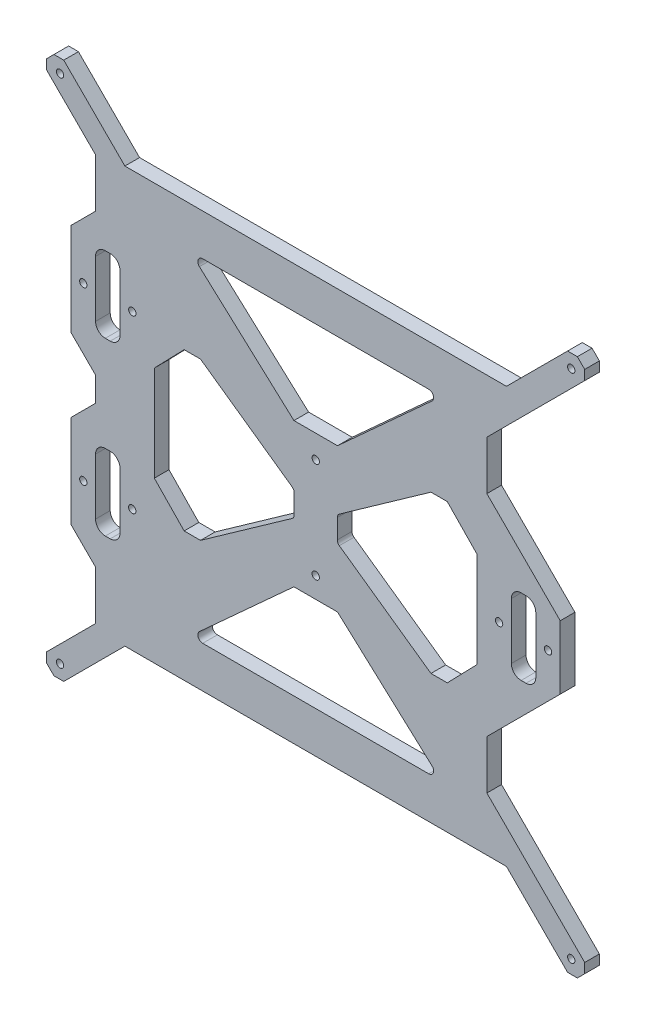
from build123d import *

# Parameters (mm, degrees)
FRAME_R             = 1.5
BOSS_EXTRUDE1_DEPTH = 6


with BuildPart() as part:
    # FRAME → Boss-Extrude1 (new body)
    with BuildSketch(Plane.XY):
        Polygon((65, 325), (63, 325), (60, 322), (60, 320), (60, 318), (80, 298), (80, 278), (70, 268), (70, 230), (80, 220), (80, 210), (70, 200), (70, 162), (80, 152), (80, 132), (60, 112), (60, 108), (63, 105), (65, 105), (67, 105), (92, 130), (248, 130), (273, 105), (275, 105), (277, 105), (280, 108), (280, 112), (260, 132), (240, 152), (240, 172), (260, 192), (270, 202), (270, 228), (260, 238), (240, 258), (240, 278), (280, 318), (280, 321), (280, 322), (277, 325), (273, 325), (250, 302), (248, 300), (92, 300), (67, 325), align=None)
        with Locations((75, 250)):
            Circle(FRAME_R, mode=Mode.SUBTRACT)
        with Locations((95.037619408, 250)):
            Circle(FRAME_R, mode=Mode.SUBTRACT)
        with Locations((75, 180)):
            Circle(FRAME_R, mode=Mode.SUBTRACT)
        with Locations((95, 180)):
            Circle(FRAME_R, mode=Mode.SUBTRACT)
        with Locations((265, 215)):
            Circle(FRAME_R, mode=Mode.SUBTRACT)
        with Locations((245, 215)):
            Circle(FRAME_R, mode=Mode.SUBTRACT)
        with Locations((65.5, 319.5)):
            Circle(FRAME_R, mode=Mode.SUBTRACT)
        with Locations((274.5, 110.5)):
            Circle(FRAME_R, mode=Mode.SUBTRACT)
        with Locations((274.5, 319.5)):
            Circle(FRAME_R, mode=Mode.SUBTRACT)
        with Locations((65.5, 110.5)):
            Circle(FRAME_R, mode=Mode.SUBTRACT)
        with Locations((170.024675872, 194)):
            Circle(FRAME_R, mode=Mode.SUBTRACT)
        with Locations((170.024675872, 235)):
            Circle(FRAME_R, mode=Mode.SUBTRACT)
        with BuildLine():
            Line((161.216590497, 218.964796722), (161.216590497, 211.035203278))
            ThreePointArc((161.216590497, 211.035203278), (160.992764596, 210.115852653), (160.371384926, 209.402276511))
            Line((160.371384926, 209.402276511), (122.909474642, 182.909474642))
            Line((122.909474642, 182.909474642), (116.23015359, 182.909474642))
            Line((116.23015359, 182.909474642), (104.037619408, 195.501934511))
            Line((104.037619408, 195.501934511), (104.037619408, 234.498065489))
            Line((104.037619408, 234.498065489), (116.23015359, 247.090525358))
            Line((116.23015359, 247.090525358), (122.909474642, 247.090525358))
            Line((122.909474642, 247.090525358), (160.371384926, 220.597723489))
            ThreePointArc((160.371384926, 220.597723489), (160.992764596, 219.884147347), (161.216590497, 218.964796722))
        make_face(mode=Mode.SUBTRACT)
        with BuildLine():
            Line((122.471056888, 279.600410825), (161.114699893, 244.435797428))
            Line((161.114699893, 244.435797428), (178.934651851, 244.435797428))
            Line((178.934651851, 244.435797428), (217.578294856, 279.600410825))
            ThreePointArc((217.578294856, 279.600410825), (218.0975061, 281.801285282), (216.232236245, 283.079642455))
            Line((216.232236245, 283.079642455), (123.817115499, 283.079642455))
            ThreePointArc((123.817115499, 283.079642455), (121.951845644, 281.801285282), (122.471056888, 279.600410825))
        make_face(mode=Mode.SUBTRACT)
        with BuildLine():
            Line((217.139877102, 247.090525358), (179.677966818, 220.597723489))
            ThreePointArc((179.677966818, 220.597723489), (179.056587148, 219.884147347), (178.832761247, 218.964796722))
            Line((178.832761247, 218.964796722), (178.832761247, 211.035203278))
            ThreePointArc((178.832761247, 211.035203278), (179.056587148, 210.115852653), (179.677966818, 209.402276511))
            Line((179.677966818, 209.402276511), (217.139877102, 182.909474642))
            Line((217.139877102, 182.909474642), (223.819198154, 182.909474642))
            Line((223.819198154, 182.909474642), (236.011732336, 195.501934511))
            Line((236.011732336, 195.501934511), (236.011732336, 234.498065489))
            Line((236.011732336, 234.498065489), (223.819198154, 247.090525358))
            Line((223.819198154, 247.090525358), (217.139877102, 247.090525358))
        make_face(mode=Mode.SUBTRACT)
        with BuildLine():
            Line((217.578294856, 150.399589175), (178.934651851, 185.564202572))
            Line((178.934651851, 185.564202572), (161.114699893, 185.564202572))
            Line((161.114699893, 185.564202572), (122.471056888, 150.399589175))
            ThreePointArc((122.471056888, 150.399589175), (121.951845644, 148.198714718), (123.817115499, 146.920357545))
            Line((123.817115499, 146.920357545), (216.232236245, 146.920357545))
            ThreePointArc((216.232236245, 146.920357545), (218.0975061, 148.198714718), (217.578294856, 150.399589175))
        make_face(mode=Mode.SUBTRACT)
        with BuildLine():
            Line((80, 169), (80, 192))
            ThreePointArc((80, 192), (81.171572875, 194.828427125), (84, 196))
            Line((84, 196), (86, 196))
            ThreePointArc((86, 196), (88.828427125, 194.828427125), (90, 192))
            Line((90, 192), (90, 169))
            ThreePointArc((90, 169), (88.828427125, 166.171572875), (86, 165))
            Line((86, 165), (84, 165))
            ThreePointArc((84, 165), (81.171572875, 166.171572875), (80, 169))
        make_face(mode=Mode.SUBTRACT)
        with BuildLine():
            Line((80, 239.007036896), (80, 262.007036896))
            ThreePointArc((80, 262.007036896), (81.171572875, 264.835464021), (84, 266.007036896))
            Line((84, 266.007036896), (86, 266.007036896))
            ThreePointArc((86, 266.007036896), (88.828427125, 264.835464021), (90, 262.007036896))
            Line((90, 262.007036896), (90, 239.007036896))
            ThreePointArc((90, 239.007036896), (88.828427125, 236.178609771), (86, 235.007036896))
            Line((86, 235.007036896), (84, 235.007036896))
            ThreePointArc((84, 235.007036896), (81.171572875, 236.178609771), (80, 239.007036896))
        make_face(mode=Mode.SUBTRACT)
        with BuildLine():
            Line((250, 202.862876393), (250, 225.862876393))
            ThreePointArc((250, 225.862876393), (251.171572875, 228.691303518), (254, 229.862876393))
            Line((254, 229.862876393), (256, 229.862876393))
            ThreePointArc((256, 229.862876393), (258.828427125, 228.691303518), (260, 225.862876393))
            Line((260, 225.862876393), (260, 202.862876393))
            ThreePointArc((260, 202.862876393), (258.828427125, 200.034449268), (256, 198.862876393))
            Line((256, 198.862876393), (254, 198.862876393))
            ThreePointArc((254, 198.862876393), (251.171572875, 200.034449268), (250, 202.862876393))
        make_face(mode=Mode.SUBTRACT)
    extrude(amount=BOSS_EXTRUDE1_DEPTH)


solid = part.part
